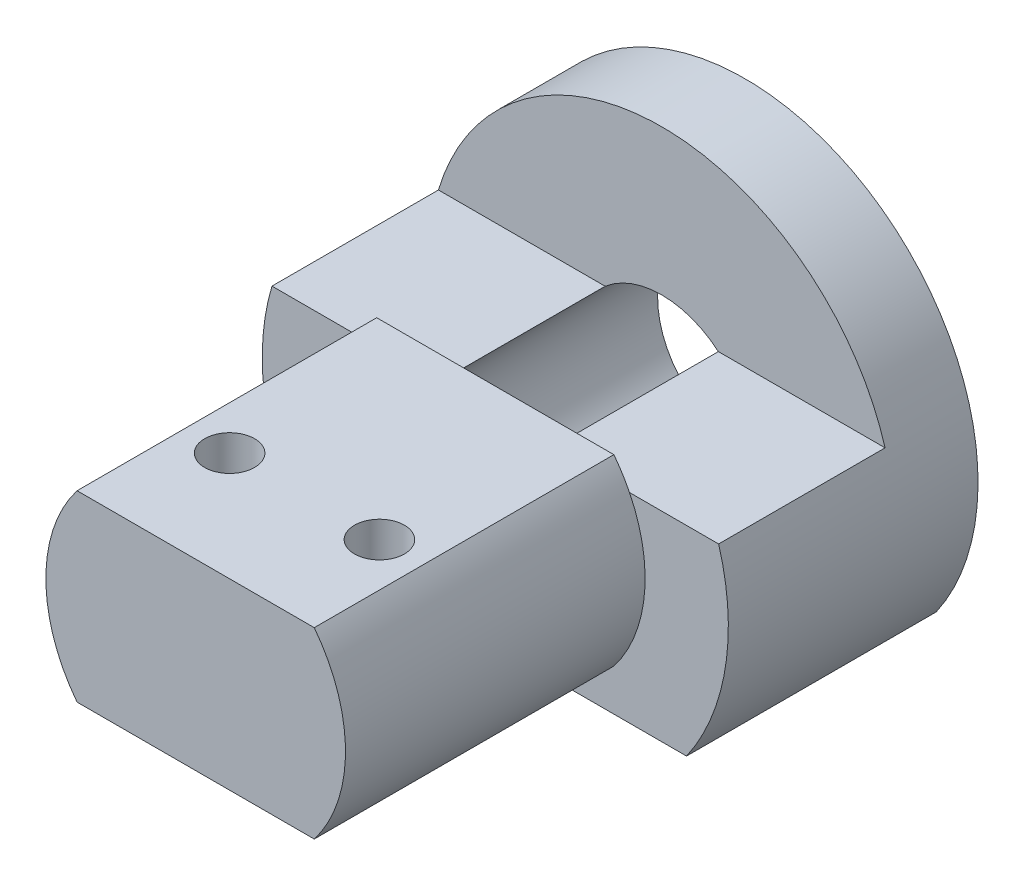
from build123d import *

# Parameters (mm, degrees)
SKETCH_1_R          = 5.25
EXTRUDE_1_DEPTH     = 15
CUT_EXTRUDE_START   = -10
CUT_EXTRUDE_1_DEPTH = 10
EXTRUDE_2_DEPTH     = 18
SKETCH_4_R          = 1.5
CUT_EXTRUDE_2_DEPTH = 39.304699451


with BuildPart() as part:
    # 草图1 → 凸台-拉伸1 (new body)
    with BuildSketch(Plane.XY):
        with BuildLine():
            Line((-11.489125293, -8), (11.489125293, -8))
            ThreePointArc((11.489125293, -8), (0, 14), (-11.489125293, -8))
        make_face()
        Circle(SKETCH_1_R, mode=Mode.SUBTRACT)
    extrude(amount=EXTRUDE_1_DEPTH)

    # 草图2 → 切除-拉伸1 (cut)
    with BuildSketch(Plane.XY.offset(15).offset(CUT_EXTRUDE_START)):
        with BuildLine():
            Line((-13.416407865, 4), (13.416407865, 4))
            ThreePointArc((13.416407865, 4), (0, 14), (-13.416407865, 4))
        make_face()
    extrude(amount=CUT_EXTRUDE_1_DEPTH, mode=Mode.SUBTRACT)

    # 草图3 → 凸台-拉伸2 (add)
    with BuildSketch(Plane.XY.offset(15)):
        with BuildLine():
            Line((-7.123903424, 5.5), (7.123903424, 5.5))
            ThreePointArc((7.123903424, 5.5), (9, 0), (7.123903424, -5.5))
            Line((7.123903424, -5.5), (-7.123903424, -5.5))
            ThreePointArc((-7.123903424, -5.5), (-9, 0), (-7.123903424, 5.5))
        make_face()
    extrude(amount=EXTRUDE_2_DEPTH)

    # 草图4 → 切除-拉伸2 (cut, through all)
    with BuildSketch(Plane(origin=(0, 5.5, 0), x_dir=(1, 0, 0), z_dir=(0, 1, 0))):
        with Locations((4.5, -26.46)):
            Circle(SKETCH_4_R)
        with Locations((-4.5, -26.46)):
            Circle(SKETCH_4_R)
    extrude(amount=-CUT_EXTRUDE_2_DEPTH, mode=Mode.SUBTRACT)


solid = part.part
